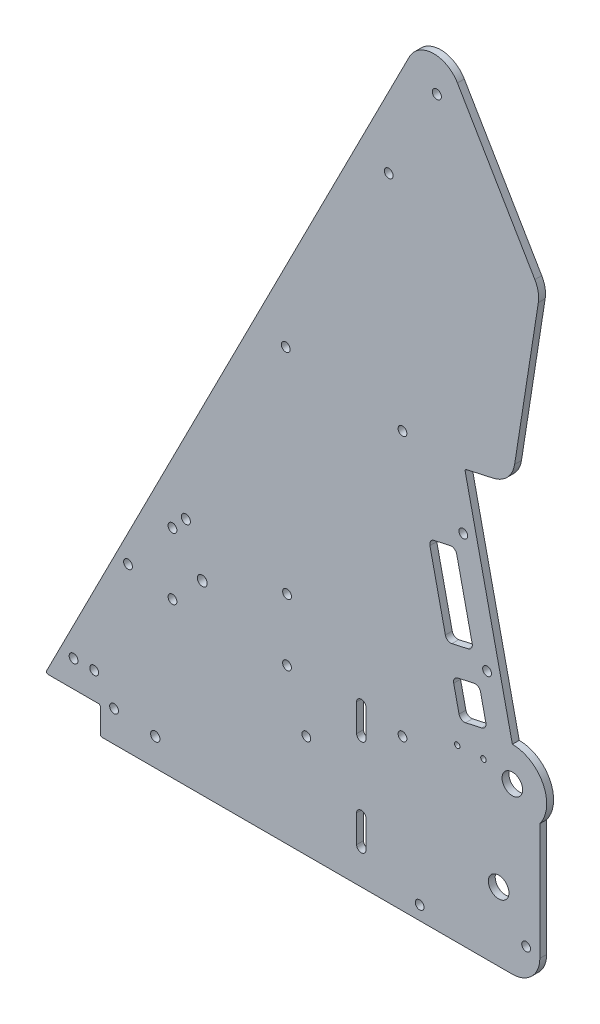
from build123d import *

# Parameters (mm, degrees)
BOSS_EXTRUDE1_DEPTH     = 3.175
SKETCH2_R               = 2.0955
SKETCH2_R_2             = 2.286
SKETCH2_R_3             = 2.032
SKETCH2_R_4             = 4.7625
CUT_EXTRUDE1_DEPTH      = 421.976111717
SKETCH7_R               = 2.159
CUT_EXTRUDE2_DEPTH      = 421.976111717
CUT_EXTRUDE3_REACH      = 422.976
SKETCH10_R              = 2.032
FILLET1_R               = 12.7
FILLET2_R               = 0.79375
SKETCH12_R              = 2.032
CUT_EXTRUDE5_DEPTH      = 410.593447353
SKETCH13_R              = 2.032
CUT_EXTRUDE6_DEPTH      = 410.593447353
CUT_EXTRUDE7_DEPTH      = 410.593447353
CUT_EXTRUDE7_DEPTH_BACK = 410.593447353
SKETCH14_R              = 1.27
FILLET3_R               = 2.54


with BuildPart() as part:
    # Sketch1 → Boss-Extrude1 (new body)
    with BuildSketch(Plane.XY):
        with BuildLine():
            Line((228.6, -12.7), (228.6, 53.975))
            ThreePointArc((228.6, 53.975), (230.099031657, 70.599515829), (215.9, 79.375))
            Line((215.9, 79.375), (193.909735224, 178.566674323))
            Line((193.909735224, 178.566674323), (215.607913982, 183.377044743))
            Line((215.607913982, 183.377044743), (228.6, 266.7))
            Line((228.6, 266.7), (178.754725958, 351.413083686))
            Line((178.754725958, 351.413083686), (0, 0))
            Line((0, 0), (25.4, 0))
            Line((25.4, 0), (25.4, -12.7))
            Line((25.4, -12.7), (228.6, -12.7))
        make_face()
    extrude(amount=BOSS_EXTRUDE1_DEPTH)

    # Sketch2 → Cut-Extrude1 (cut, through all)
    with BuildSketch(Plane.XY.offset(3.175)):
        with Locations((64.943150167, 94.057839899)):
            Circle(SKETCH2_R)
        with Locations((180.975, 322.164313376)):
            Circle(SKETCH2_R)
        with Locations((72.544547852, 73.173171402)):
            Circle(SKETCH2_R_2)
        with Locations((193.207821773, 152.394364194)):
            Circle(SKETCH2_R_3)
        with Locations((215.9, 63.5)):
            Circle(SKETCH2_R_4)
        with Locations((173.0375, -6.35)):
            Circle(SKETCH2_R_3)
        with Locations((204.202954161, 102.798527032)):
            Circle(SKETCH2_R_3)
        with Locations((209.55, 19.05)):
            Circle(SKETCH2_R_4)
        with Locations((165.1, 179.3875)):
            Circle(SKETCH2_R_3)
        with Locations((111.724047852, 87.460671402)):
            Circle(SKETCH2_R_3)
        with Locations((111.724047852, 58.885671402)):
            Circle(SKETCH2_R_3)
        with Locations((58.765047852, 58.885671402)):
            Circle(SKETCH2_R_3)
        with Locations((58.765047852, 87.460671402)):
            Circle(SKETCH2_R_3)
    extrude(amount=-CUT_EXTRUDE1_DEPTH, mode=Mode.SUBTRACT)

    # Sketch7 → Cut-Extrude2 (cut, through all)
    with BuildSketch(Plane.XY.offset(3.175)):
        with Locations((50.8, 0)):
            Circle(SKETCH7_R)
        with BuildLine():
            Line((143.891, 3.175), (143.891, 15.875))
            ThreePointArc((143.891, 15.875), (146.05, 18.034), (148.209, 15.875))
            Line((148.209, 15.875), (148.209, 3.175))
            ThreePointArc((148.209, 3.175), (146.05, 1.016), (143.891, 3.175))
        make_face()
        with BuildLine():
            Line((143.891, 47.625), (143.891, 60.325))
            ThreePointArc((143.891, 60.325), (146.05, 62.484), (148.209, 60.325))
            Line((148.209, 60.325), (148.209, 47.625))
            ThreePointArc((148.209, 47.625), (146.05, 45.466), (143.891, 47.625))
        make_face()
    extrude(amount=-CUT_EXTRUDE2_DEPTH, mode=Mode.SUBTRACT)

    # Sketch10 → Cut-Extrude3 (cut, up to next)
    with BuildSketch(Plane.XY.offset(3.175), mode=Mode.PRIVATE) as cut_extrude3_sk1:
        with Locations((120.65, 34.925)):
            Circle(SKETCH10_R)
    cut_extrude3_tool1 = extrude(cut_extrude3_sk1.sketch, amount=-CUT_EXTRUDE3_REACH, mode=Mode.PRIVATE) & part.part
    # Sketch10 → Cut-Extrude3 (cut, up to next)
    with BuildSketch(Plane.XY.offset(3.175), mode=Mode.PRIVATE) as cut_extrude3_sk2:
        with Locations((165.1, 57.15)):
            Circle(SKETCH10_R)
    cut_extrude3_tool2 = extrude(cut_extrude3_sk2.sketch, amount=-CUT_EXTRUDE3_REACH, mode=Mode.PRIVATE) & part.part
    # Sketch10 → Cut-Extrude3 (cut, up to next)
    with BuildSketch(Plane.XY.offset(3.175), mode=Mode.PRIVATE) as cut_extrude3_sk3:
        with Locations((13.046467246, 12.334704411)):
            Circle(SKETCH10_R)
    cut_extrude3_tool3 = extrude(cut_extrude3_sk3.sketch, amount=-CUT_EXTRUDE3_REACH, mode=Mode.PRIVATE) & part.part
    # Sketch10 → Cut-Extrude3 (cut, up to next)
    with BuildSketch(Plane.XY.offset(3.175), mode=Mode.PRIVATE) as cut_extrude3_sk4:
        with Locations((22.571467246, 12.334704411)):
            Circle(SKETCH10_R)
    cut_extrude3_tool4 = extrude(cut_extrude3_sk4.sketch, amount=-CUT_EXTRUDE3_REACH, mode=Mode.PRIVATE) & part.part
    # Sketch10 → Cut-Extrude3 (cut, up to next)
    with BuildSketch(Plane.XY.offset(3.175), mode=Mode.PRIVATE) as cut_extrude3_sk5:
        with Locations((38.211447917, 62.639810909)):
            Circle(SKETCH10_R)
    cut_extrude3_tool5 = extrude(cut_extrude3_sk5.sketch, amount=-CUT_EXTRUDE3_REACH, mode=Mode.PRIVATE) & part.part
    add(cut_extrude3_tool1.solids().sort_by_distance((120.65, 34.925, 3.175))[0], mode=Mode.SUBTRACT)
    add(cut_extrude3_tool2.solids().sort_by_distance((165.1, 57.15, 3.175))[0], mode=Mode.SUBTRACT)
    add(cut_extrude3_tool3.solids().sort_by_distance((13.046467, 12.334704, 3.175))[0], mode=Mode.SUBTRACT)
    add(cut_extrude3_tool4.solids().sort_by_distance((22.571467, 12.334704, 3.175))[0], mode=Mode.SUBTRACT)
    add(cut_extrude3_tool5.solids().sort_by_distance((38.211448, 62.639811, 3.175))[0], mode=Mode.SUBTRACT)

    # Fillet1
    fillet1_edges = [part.edges().sort_by_distance(p)[0] for p in [
        (228.6, -12.7, 1.5875),
        (178.754725958, 351.413083686, 1.5875),
        (215.607913982, 183.377044743, 1.5875),
        (228.6, 266.7, 1.5875),
    ]]
    fillet(fillet1_edges, radius=FILLET1_R)

    # Fillet2
    fillet2_edges = [part.edges().sort_by_distance(p)[0] for p in [
        (25.4, -12.7, 1.5875),
        (25.4, 0, 1.5875),
        (193.909735224, 178.566674323, 1.5875),
        (0, 0, 1.5875),
    ]]
    fillet(fillet2_edges, radius=FILLET2_R)

    # Sketch12 → Cut-Extrude5 (cut, through all)
    with BuildSketch(Plane.XY.offset(3.175)):
        with Locations((31.75, 1.5875)):
            Circle(SKETCH12_R)
        with Locations((173.0375, -6.35)):
            Circle(SKETCH12_R)
        with Locations((222.25, 1.5875)):
            Circle(SKETCH12_R)
    extrude(amount=-CUT_EXTRUDE5_DEPTH, mode=Mode.SUBTRACT)

    # Sketch13 → Cut-Extrude6 (cut, through all)
    with BuildSketch(Plane.XY.offset(3.175)):
        with Locations((111.125, 186.055)):
            Circle(SKETCH13_R)
        with Locations((158.75, 279.4)):
            Circle(SKETCH13_R)
    extrude(amount=-CUT_EXTRUDE6_DEPTH, mode=Mode.SUBTRACT)

    # Sketch14 → Cut-Extrude7 (cut, two sides: drawn at the far end of the back side and taken through both)
    with BuildSketch(Plane.XY.offset(3.175).offset(-CUT_EXTRUDE7_DEPTH_BACK)):
        with Locations((190.426832263, 66.260948917)):
            Circle(SKETCH14_R)
        with Locations((202.533497378, 66.789537331)):
            Circle(SKETCH14_R)
        Polygon((177.223670315, 142.346588213), (189.622629605, 145.09537131), (197.868978896, 107.898493439), (185.470019606, 105.149710342), align=None)
        Polygon((188.218802703, 92.750751051), (200.617761993, 95.499534148), (204.191180019, 79.380887071), (191.792220729, 76.632103974), align=None)
    extrude(amount=CUT_EXTRUDE7_DEPTH + CUT_EXTRUDE7_DEPTH_BACK, mode=Mode.SUBTRACT)

    # Fillet3
    fillet3_edges = [part.edges().sort_by_distance(p)[0] for p in [
        (200.617761993, 95.499534148, 1.5875),
        (188.218802703, 92.750751051, 1.5875),
        (191.792220729, 76.632103974, 1.5875),
        (204.191180019, 79.380887071, 1.5875),
        (197.868978896, 107.898493439, 1.5875),
        (185.470019606, 105.149710342, 1.5875),
        (177.223670315, 142.346588213, 1.5875),
        (189.622629605, 145.09537131, 1.5875),
    ]]
    fillet(fillet3_edges, radius=FILLET3_R)


solid = part.part
